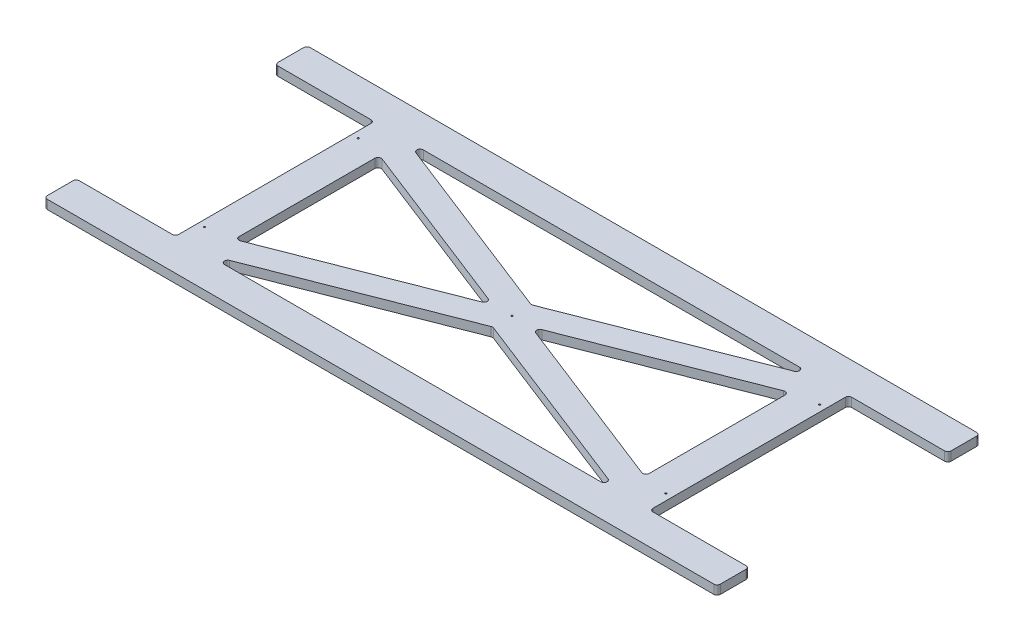
from build123d import *

# Parameters (mm, degrees)
SKETCH1_W                    = 1333.5
SKETCH1_H                    = 520.7
BOSS_EXTRUDE1_DEPTH          = 17.78
FILLET1_R                    = 6.35
F_1_8_0_125_DIAMETER_HOLE1_D = 3.175
SKETCH5_W                    = 152.4
SKETCH5_H                    = 393.7
CUT_EXTRUDE1_DEPTH           = 716.998473043
FILLET2_R                    = 6.35
SKETCH6_W                    = 50.8
SKETCH6_H                    = 393.7
CUT_EXTRUDE2_DEPTH           = 716.998473043
FILLET3_R                    = 6.35


with BuildPart() as part:
    # Sketch1 → Boss-Extrude1 (new body)
    with BuildSketch(Plane(origin=(0, 0, 0), x_dir=(1, 0, 0), z_dir=(0, 1, 0))):
        Rectangle(SKETCH1_W, SKETCH1_H)
    extrude(amount=BOSS_EXTRUDE1_DEPTH)

    # Fillet1
    fillet1_edges = [part.edges().sort_by_distance(p)[0] for p in [
        (-666.75, 8.89, 260.35),
        (-666.75, 8.89, -260.35),
        (666.75, 8.89, -260.35),
        (666.75, 8.89, 260.35),
    ]]
    fillet(fillet1_edges, radius=FILLET1_R)

    # 1/8 (0.125) Diameter Hole1 (through all)
    with Locations(Plane(origin=(0, 17.78, 0), x_dir=(1, 0, 0), z_dir=(0, 1, 0))):
        with Locations((0, 0), (457.2, 152.4), (-457.2, -152.4), (-457.2, 152.4), (457.2, -152.4)):
            Hole(F_1_8_0_125_DIAMETER_HOLE1_D / 2)

    # Sketch5 → Cut-Extrude1 (cut, through all)
    with BuildSketch(Plane(origin=(0, 17.78, 0), x_dir=(1, 0, 0), z_dir=(0, 1, 0))):
        Polygon((-406.4, 196.85), (406.4, 196.85), (0, 38.1), align=None)
        Polygon((0, -38.1), (-406.4, -196.85), (406.4, -196.85), align=None)
        Polygon((406.4, 143.8671875), (406.4, -143.8671875), (38.1, 0), align=None)
        Polygon((-406.4, 143.8671875), (-38.1, 0), (-406.4, -143.8671875), align=None)
        with Locations((546.1, 0)):
            Rectangle(SKETCH5_W, SKETCH5_H)
        with Locations((-546.1, 0)):
            Rectangle(SKETCH5_W, SKETCH5_H)
    extrude(amount=-CUT_EXTRUDE1_DEPTH, mode=Mode.SUBTRACT)

    # Fillet2
    fillet2_edges = [part.edges().sort_by_distance(p)[0] for p in [
        (469.9, 8.89, -196.85),
        (469.9, 8.89, 196.85),
        (622.3, 8.89, 196.85),
        (406.4, 8.89, 143.8671875),
        (406.4, 8.89, 196.85),
        (622.3, 8.89, -196.85),
        (406.4, 8.89, -143.8671875),
        (406.4, 8.89, -196.85),
        (38.1, 8.89, 0),
        (0, 8.89, 38.1),
        (0, 8.89, -38.1),
        (-38.1, 8.89, 0),
        (-406.4, 8.89, 196.85),
        (-406.4, 8.89, -196.85),
        (-406.4, 8.89, -143.8671875),
        (-406.4, 8.89, 143.8671875),
        (-622.3, 8.89, 196.85),
        (-469.9, 8.89, 196.85),
        (-469.9, 8.89, -196.85),
        (-622.3, 8.89, -196.85),
    ]]
    fillet(fillet2_edges, radius=FILLET2_R)

    # Sketch6 → Cut-Extrude2 (cut, through all)
    with BuildSketch(Plane(origin=(0, 17.78, 0), x_dir=(1, 0, 0), z_dir=(0, 1, 0))):
        with Locations((641.35, 0)):
            Rectangle(SKETCH6_W, SKETCH6_H)
        with Locations((-641.35, 0)):
            Rectangle(SKETCH6_W, SKETCH6_H)
    extrude(amount=-CUT_EXTRUDE2_DEPTH, mode=Mode.SUBTRACT)

    # Fillet3
    fillet3_edges = [part.edges().sort_by_distance(p)[0] for p in [
        (-666.75, 8.89, 196.85),
        (-666.75, 8.89, -196.85),
        (666.75, 8.89, -196.85),
        (666.75, 8.89, 196.85),
    ]]
    fillet(fillet3_edges, radius=FILLET3_R)


solid = part.part
